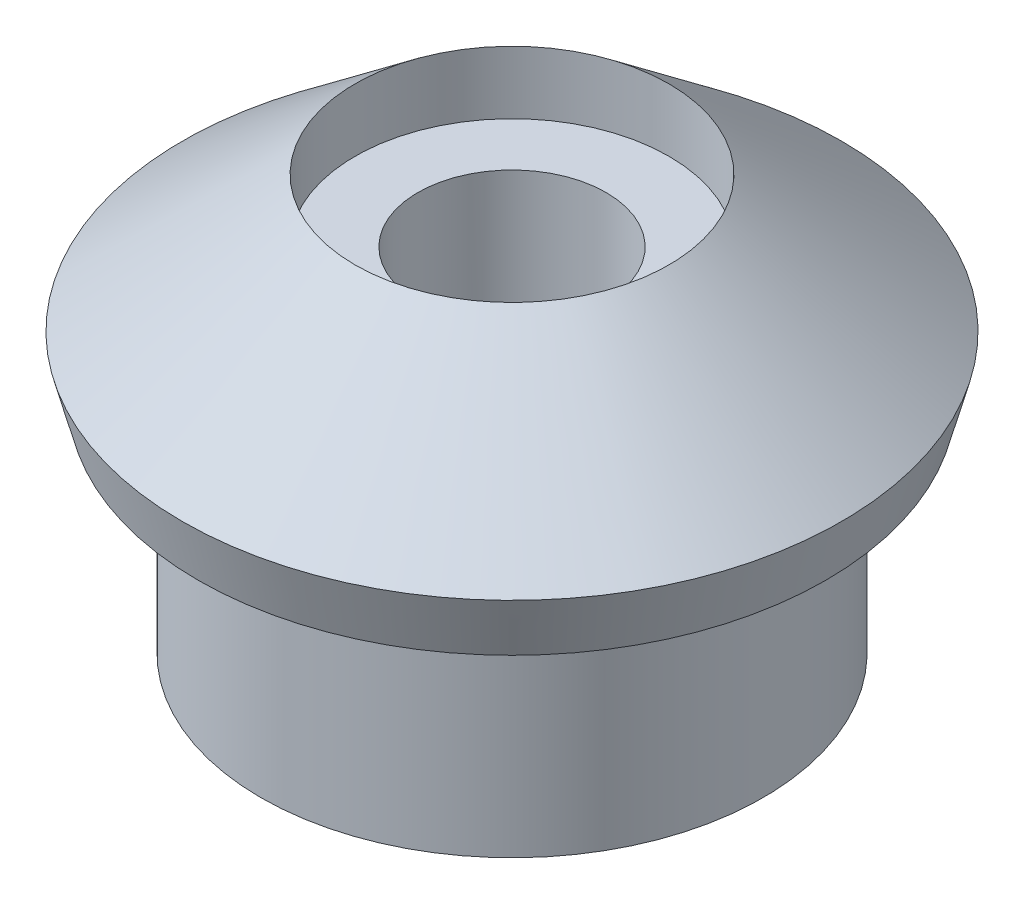
from build123d import *

# Parameters (mm, degrees)
SKETCH_2_R          = 3
CUT_EXTRUDE_1_DEPTH = 20.868064828
SKETCH_3_R          = 1.5
CUT_EXTRUDE_2_DEPTH = 20.868064828


with BuildPart() as part:
    # 草图1 → 旋转1 (revolve)
    with BuildSketch(Plane(origin=(0, 0, 0), x_dir=(0, 0, -1), z_dir=(1, 0, 0))):
        Polygon((0, 11.2), (5, 11.2), (5, 13.2), (10.5, 8.869872981), (10, 7), (8, 7), (8, 0), (0, 0), align=None)
    revolve(axis=Axis((0, 56.941665612, 0), (0, -1, 0)))

    # 草图2 → 切除-拉伸1 (cut, through all)
    with BuildSketch(Plane.XZ):
        Circle(SKETCH_2_R)
    extrude(amount=-CUT_EXTRUDE_1_DEPTH, mode=Mode.SUBTRACT)

    # 草图3 → 切除-拉伸2 (cut, through all)
    with BuildSketch(Plane(origin=(0, 0, 0), x_dir=(0, 0, -1), z_dir=(1, 0, 0))):
        with Locations((0, 3)):
            Circle(SKETCH_3_R)
    extrude(amount=-CUT_EXTRUDE_2_DEPTH, mode=Mode.SUBTRACT)


solid = part.part
